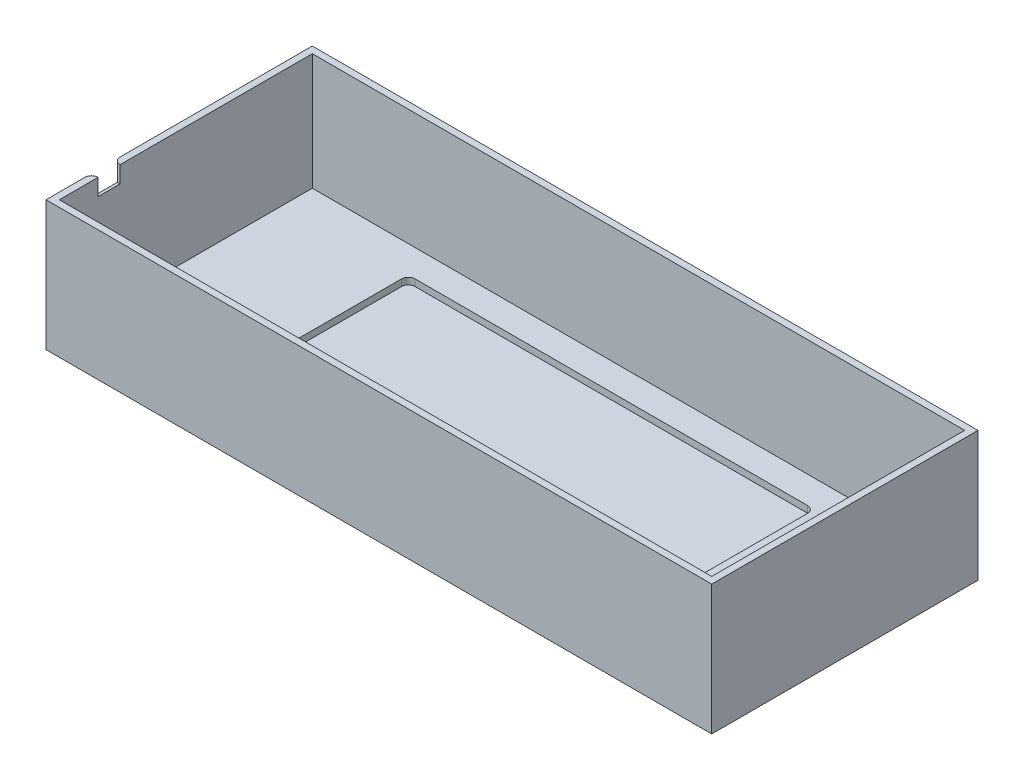
from build123d import *

# Parameters (mm, degrees)
SKETCH2_W           = 200
SKETCH2_H           = 80
BOSS_EXTRUDE3_DEPTH = 37
SHELL2_T            = -2
SKETCH3_W           = 122
SKETCH3_H           = 59.69
CUT_EXTRUDE1_DEPTH  = 2
SKETCH4_W           = 200
SKETCH4_H           = 80
BOSS_EXTRUDE4_DEPTH = 2
FILLET5_R           = 2
SKETCH7_W           = 6.575531056
SKETCH7_H           = 5
CUT_EXTRUDE2_DEPTH  = 5
FILLET6_R           = 2


with BuildPart() as part:
    # Sketch2 → Boss-Extrude3 (new body)
    with BuildSketch(Plane(origin=(0, 0, 0), x_dir=(1, 0, 0), z_dir=(0, 1, 0))):
        Rectangle(SKETCH2_W, SKETCH2_H)
    extrude(amount=BOSS_EXTRUDE3_DEPTH)

    # Shell2
    shell2_openings = [part.faces().sort_by_distance(p)[0] for p in [
        (0, 37, 0),
    ]]
    offset(amount=SHELL2_T, openings=shell2_openings, kind=Kind.INTERSECTION)

    # Sketch3 → Cut-Extrude1 (cut)
    with BuildSketch(Plane(origin=(0, 2, 0), x_dir=(1, 0, 0), z_dir=(0, 1, 0))):
        Rectangle(SKETCH3_W, SKETCH3_H)
    extrude(amount=-CUT_EXTRUDE1_DEPTH, mode=Mode.SUBTRACT)

    # Sketch4 → Boss-Extrude4 (add)
    with BuildSketch(Plane.XZ):
        Rectangle(SKETCH4_W, SKETCH4_H)
    extrude(amount=BOSS_EXTRUDE4_DEPTH)

    # Fillet5
    fillet5_edges = [part.edges().sort_by_distance(p)[0] for p in [
        (-61, 1, 29.845),
        (-61, 1, -29.845),
        (61, 1, -29.845),
        (61, 1, 29.845),
    ]]
    fillet(fillet5_edges, radius=FILLET5_R)

    # Sketch7 → Cut-Extrude2 (cut)
    with BuildSketch(Plane.ZY.offset(100)):
        with Locations((23.042234472, 34.5)):
            Rectangle(SKETCH7_W, SKETCH7_H)
    extrude(amount=-CUT_EXTRUDE2_DEPTH, mode=Mode.SUBTRACT)

    # Fillet6
    fillet6_edges = [part.edges().sort_by_distance(p)[0] for p in [
        (-100, 34.5, 26.33),
        (-100, 34.5, 19.754468944),
        (-100, 32, 23.042234472),
    ]]
    fillet(fillet6_edges, radius=FILLET6_R - 0.0001)  # a hair under: the kernel refuses the full size


solid = part.part
